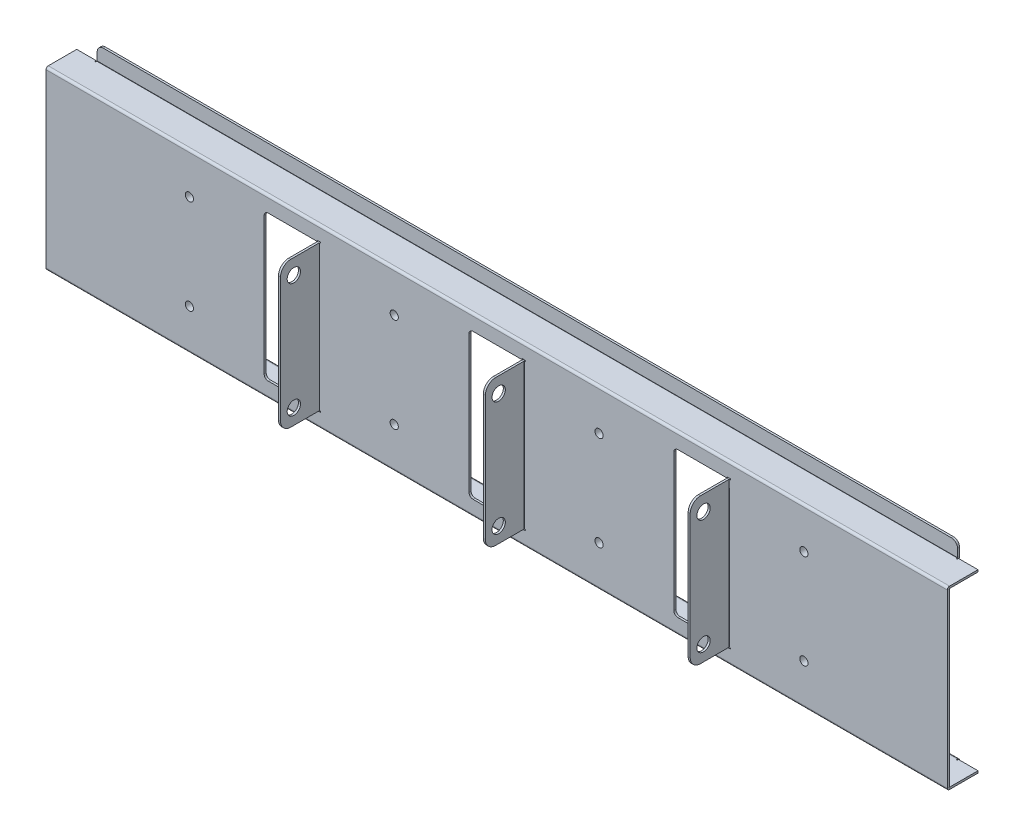
from build123d import *

# Parameters (mm, degrees)
SKETCH_1_W                          = 440
SKETCH_1_H                          = 86
SM_BASE_FLANGE_1_DEPTH              = 1
SM_EDGE_FLANGE_1_STRIP_W            = 4.2
SM_EDGE_FLANGE_1_STRIP_H            = 1
SM_EDGE_FLANGE_1_STRIP_CUT_DEPTH    = 440
SM_EDGE_FLANGE_1_STRIP_2_W          = 4.2
SM_EDGE_FLANGE_1_STRIP_2_H          = 1
SM_EDGE_FLANGE_1_STRIP_CUT_2_DEPTH  = 440
SM_EDGE_FLANGE_1_DEPTH              = 440
SM_EDGE_FLANGE_1_BEND_DEPTH         = 440
SM_EDGE_FLANGE_2_STRIP_W            = 5.2
SM_EDGE_FLANGE_2_STRIP_H            = 1
SM_EDGE_FLANGE_2_STRIP_CUT_DEPTH    = 420
SM_EDGE_FLANGE_2_RELIEF_W           = 5.7
SM_EDGE_FLANGE_2_RELIEF_H           = 0.5
SM_EDGE_FLANGE_2_RELIEF_CUT_DEPTH   = 1
SM_EDGE_FLANGE_2_STRIP_2_W          = 5.2
SM_EDGE_FLANGE_2_STRIP_2_H          = 1
SM_EDGE_FLANGE_2_STRIP_CUT_2_DEPTH  = 420
SM_EDGE_FLANGE_2_RELIEF_2_W         = 5.7
SM_EDGE_FLANGE_2_RELIEF_2_H         = 0.5
SM_EDGE_FLANGE_2_RELIEF_CUT_2_DEPTH = 1
SM_EDGE_FLANGE_2_DEPTH              = 420
SM_EDGE_FLANGE_2_BEND_DEPTH         = 420
SKETCH_18_W                         = 26
SKETCH_18_H                         = 71
CUT_EXTRUDE_1_DEPTH                 = 10
SM_START                            = -36
SM_EDGE_FLANGE_3_DEPTH              = 72
SM_EDGE_FLANGE_3_2_DEPTH            = 0.5
SM_START_2                          = 35.5
SM_EDGE_FLANGE_3_3_DEPTH            = 0.5
SM_START_3                          = -35.5
SM_EDGE_FLANGE_3_4_DEPTH            = 71
SKETCH_22_R                         = 3.25
CUT_EXTRUDE_2_DEPTH                 = 10
FILLET_1_R                          = 5
PATTERN_LINEAR_4_COUNT              = 2
PATTERN_LINEAR_4_PITCH              = 100
FILLET_1_OF_PATTERN_LINEAR_4_R      = 5
PATTERN_LINEAR_5_COUNT              = 2
PATTERN_LINEAR_5_PITCH              = 100
FILLET_1_OF_PATTERN_LINEAR_5_R      = 5
FILLET_2_R                          = 3
FILLET_3_R                          = 2
SKETCH_23_R                         = 2
CUT_EXTRUDE_3_DEPTH                 = 10
SKETCH_24_R                         = 4
SKETCH_24_R_2                       = 2
EXTRUDE_1_DEPTH                     = 3


# Read off the part's stored shape, not the designer's step: 边线-法兰3
# Sheet-metal steps are written as plain solids
with BuildPart() as part:
    # Sketch 1 → 基体-法兰1 (new body)
    with BuildSketch(Plane.XY):
        Rectangle(SKETCH_1_W, SKETCH_1_H)
    extrude(amount=-SM_BASE_FLANGE_1_DEPTH)

    # 边线-法兰1 strip (across the edge) → 边线-法兰1 strip cut (cut)
    with BuildSketch(Plane(origin=(-220, 43, -1), x_dir=(0, -1, 0), z_dir=(1, 0, 0))):
        with Locations((-1, -0.5)):
            Rectangle(SM_EDGE_FLANGE_1_STRIP_W, SM_EDGE_FLANGE_1_STRIP_H)
    extrude(amount=SM_EDGE_FLANGE_1_STRIP_CUT_DEPTH, mode=Mode.SUBTRACT)

    # 边线-法兰1 strip 2 (across the edge) → 边线-法兰1 strip cut 2 (cut)
    with BuildSketch(Plane(origin=(220, -43, -1), x_dir=(0, 1, 0), z_dir=(-1, 0, 0))):
        with Locations((-1, -0.5)):
            Rectangle(SM_EDGE_FLANGE_1_STRIP_2_W, SM_EDGE_FLANGE_1_STRIP_2_H)
    extrude(amount=SM_EDGE_FLANGE_1_STRIP_CUT_2_DEPTH, mode=Mode.SUBTRACT)

    # 边线-法兰1 section (across the edge) → 边线-法兰1 (add)
    with BuildSketch(Plane(origin=(-220, 43, -1), x_dir=(0, -1, 0), z_dir=(1, 0, 0))):
        with BuildLine():
            Line((0, 0.1), (0, 14))
            Line((0, 14), (1, 14))
            Line((1, 14), (1, 0.1))
            ThreePointArc((1, 0.1), (1.029289322, 0.029289322), (1.1, 0))
            Line((1.1, 0), (1.1, -1))
            ThreePointArc((1.1, -1), (0.322182541, -0.677817459), (0, 0.1))
        make_face()
    extrude(amount=SM_EDGE_FLANGE_1_DEPTH)

    # 边线-法兰1 section 2 (across the edge) → 边线-法兰1 bend (add)
    with BuildSketch(Plane(origin=(220, -43, -1), x_dir=(0, 1, 0), z_dir=(-1, 0, 0))):
        with BuildLine():
            Line((0, 0.1), (0, 14))
            Line((0, 14), (1, 14))
            Line((1, 14), (1, 0.1))
            ThreePointArc((1, 0.1), (1.029289322, 0.029289322), (1.1, 0))
            Line((1.1, 0), (1.1, -1))
            ThreePointArc((1.1, -1), (0.322182541, -0.677817459), (0, 0.1))
        make_face()
    extrude(amount=SM_EDGE_FLANGE_1_BEND_DEPTH)

    # 边线-法兰2 strip (across the edge) → 边线-法兰2 strip cut (cut)
    with BuildSketch(Plane(origin=(210, 43, -16), x_dir=(0, 0, 1), z_dir=(-1, 0, 0))):
        with Locations((-1.5, -0.5)):
            Rectangle(SM_EDGE_FLANGE_2_STRIP_W, SM_EDGE_FLANGE_2_STRIP_H)
    extrude(amount=SM_EDGE_FLANGE_2_STRIP_CUT_DEPTH, mode=Mode.SUBTRACT)

    # 边线-法兰2 relief (on the sheet) → 边线-法兰2 relief cut (cut)
    with BuildSketch(Plane(origin=(210, 43, -14.9), x_dir=(0, 0, 1), z_dir=(0, 1, 0))):
        with Locations((-2.35, 0.25)):
            Rectangle(SM_EDGE_FLANGE_2_RELIEF_W, SM_EDGE_FLANGE_2_RELIEF_H)
        with Locations((-2.35, -420.25)):
            Rectangle(SM_EDGE_FLANGE_2_RELIEF_W, SM_EDGE_FLANGE_2_RELIEF_H)
    extrude(amount=-SM_EDGE_FLANGE_2_RELIEF_CUT_DEPTH, mode=Mode.SUBTRACT)

    # 边线-法兰2 strip 2 (across the edge) → 边线-法兰2 strip cut 2 (cut)
    with BuildSketch(Plane(origin=(-210, -43, -16), x_dir=(0, 0, 1), z_dir=(1, 0, 0))):
        with Locations((-1.5, -0.5)):
            Rectangle(SM_EDGE_FLANGE_2_STRIP_2_W, SM_EDGE_FLANGE_2_STRIP_2_H)
    extrude(amount=SM_EDGE_FLANGE_2_STRIP_CUT_2_DEPTH, mode=Mode.SUBTRACT)

    # 边线-法兰2 relief 2 (on the sheet) → 边线-法兰2 relief cut 2 (cut)
    with BuildSketch(Plane(origin=(-210, -43, -14.9), x_dir=(0, 0, 1), z_dir=(0, -1, 0))):
        with Locations((-2.35, 0.25)):
            Rectangle(SM_EDGE_FLANGE_2_RELIEF_2_W, SM_EDGE_FLANGE_2_RELIEF_2_H)
        with Locations((-2.35, -420.25)):
            Rectangle(SM_EDGE_FLANGE_2_RELIEF_2_W, SM_EDGE_FLANGE_2_RELIEF_2_H)
    extrude(amount=-SM_EDGE_FLANGE_2_RELIEF_CUT_2_DEPTH, mode=Mode.SUBTRACT)

    # 边线-法兰2 section (across the edge) → 边线-法兰2 (add)
    with BuildSketch(Plane(origin=(210, 43, -16), x_dir=(0, 0, 1), z_dir=(-1, 0, 0))):
        with BuildLine():
            Line((0, 0.1), (0, 7))
            Line((0, 7), (1, 7))
            Line((1, 7), (1, 0.1))
            ThreePointArc((1, 0.1), (1.029289322, 0.029289322), (1.1, 0))
            Line((1.1, 0), (1.1, -1))
            ThreePointArc((1.1, -1), (0.322182541, -0.677817459), (0, 0.1))
        make_face()
    extrude(amount=SM_EDGE_FLANGE_2_DEPTH)

    # 边线-法兰2 section 2 (across the edge) → 边线-法兰2 bend (add)
    with BuildSketch(Plane(origin=(-210, -43, -16), x_dir=(0, 0, 1), z_dir=(1, 0, 0))):
        with BuildLine():
            Line((0, 0.1), (0, 7))
            Line((0, 7), (1, 7))
            Line((1, 7), (1, 0.1))
            ThreePointArc((1, 0.1), (1.029289322, 0.029289322), (1.1, 0))
            Line((1.1, 0), (1.1, -1))
            ThreePointArc((1.1, -1), (0.322182541, -0.677817459), (0, 0.1))
        make_face()
    extrude(amount=SM_EDGE_FLANGE_2_BEND_DEPTH)

    # 草图18 → 切除-拉伸1 (cut)
    with BuildSketch(Plane.XY):
        with Locations((-0.5, 0)):
            Rectangle(SKETCH_18_W, SKETCH_18_H)
    cut_extrude_1 = extrude(amount=-CUT_EXTRUDE_1_DEPTH, mode=Mode.SUBTRACT)

    # 边线-法兰3 outline → 边线-法兰3 (cut)
    with BuildSketch(Plane(origin=(0, 0, 0), x_dir=(1, 0, 0), z_dir=(0, 1, 0)).offset(SM_START)):
        with BuildLine():
            ThreePointArc((12.504554885, 0), (12.858380152, 0.71240384), (13.6, 1))
            Line((13.6, 1), (12.5, 1))
            Line((12.5, 1), (12.5, 0))
            Line((12.5, 0), (12.504554885, 0))
        make_face()
    sm_edge_flange_3 = extrude(amount=SM_EDGE_FLANGE_3_DEPTH, mode=Mode.SUBTRACT)

    # Sm Edge Flange 3 2 outline → Sm Edge Flange 3 2 (cut)
    with BuildSketch(Plane(origin=(0, 0, 0), x_dir=(1, 0, 0), z_dir=(0, 1, 0)).offset(SM_START)):
        with BuildLine():
            Line((14.1, 0), (14.1, 1))
            Line((14.1, 1), (13.6, 1))
            ThreePointArc((13.6, 1), (12.858380152, 0.71240384), (12.504554885, 0))
            Line((12.504554885, 0), (14.1, 0))
        make_face()
    sm_edge_flange_3_2 = extrude(amount=SM_EDGE_FLANGE_3_2_DEPTH, mode=Mode.SUBTRACT)

    # Sm Edge Flange 3 3 outline → Sm Edge Flange 3 3 (cut)
    with BuildSketch(Plane(origin=(0, 0, 0), x_dir=(1, 0, 0), z_dir=(0, 1, 0)).offset(SM_START_2)):
        with BuildLine():
            Line((14.1, 0), (14.1, 1))
            Line((14.1, 1), (13.6, 1))
            ThreePointArc((13.6, 1), (12.858380152, 0.71240384), (12.504554885, 0))
            Line((12.504554885, 0), (14.1, 0))
        make_face()
    sm_edge_flange_3_3 = extrude(amount=SM_EDGE_FLANGE_3_3_DEPTH, mode=Mode.SUBTRACT)

    # Sm Edge Flange 3 4 outline → Sm Edge Flange 3 4 (add)
    with BuildSketch(Plane(origin=(0, 0, 0), x_dir=(1, 0, 0), z_dir=(0, 1, 0)).offset(SM_START_3)):
        with BuildLine():
            ThreePointArc((13.5, -0.1), (13.529289322, -0.029289322), (13.6, 0))
            Line((13.6, 0), (12.504554885, 0))
            ThreePointArc((12.504554885, 0), (12.501139311, -0.049948159), (12.5, -0.1))
            Line((12.5, -0.1), (12.5, -19))
            Line((12.5, -19), (13.5, -19))
            Line((13.5, -19), (13.5, -0.1))
        make_face()
    sm_edge_flange_3_4 = extrude(amount=SM_EDGE_FLANGE_3_4_DEPTH)

    # 草图22 → 切除-拉伸2 (cut)
    with BuildSketch(Plane.ZY.offset(-12.5)):
        with Locations((12.5, 28)):
            Circle(SKETCH_22_R)
        with Locations((12.5, -28)):
            Circle(SKETCH_22_R)
    cut_extrude_2 = extrude(amount=-CUT_EXTRUDE_2_DEPTH, mode=Mode.SUBTRACT)

    # 圆角1
    fillet_1_edges = [part.edges().sort_by_distance(p)[0] for p in [
        (13, 35.5, 19),
        (13, -35.5, 19),
    ]]
    fillet(fillet_1_edges, radius=FILLET_1_R)

    # 阵列(线性)4: 切除-拉伸1, 边线-法兰3, Sm Edge Flange 3 2, Sm Edge Flange 3 3, Sm Edge Flange 3 4, 切除-拉伸2 ×2
    with Locations(*[(i * PATTERN_LINEAR_4_PITCH, 0, 0) for i in range(1, PATTERN_LINEAR_4_COUNT)]):
        add(cut_extrude_1, mode=Mode.SUBTRACT)
        add(sm_edge_flange_3, mode=Mode.SUBTRACT)
        add(sm_edge_flange_3_2, mode=Mode.SUBTRACT)
        add(sm_edge_flange_3_3, mode=Mode.SUBTRACT)
        add(sm_edge_flange_3_4)
        add(cut_extrude_2, mode=Mode.SUBTRACT)

    # 圆角1 of 阵列(线性)4
    fillet_1_of_pattern_linear_4_edges = [part.edges().sort_by_distance(p)[0] for p in [
        (113, 35.5, 19),
        (113, -35.5, 19),
    ]]
    fillet(fillet_1_of_pattern_linear_4_edges, radius=FILLET_1_OF_PATTERN_LINEAR_4_R)

    # 阵列(线性)5: 切除-拉伸1, 边线-法兰3, Sm Edge Flange 3 2, Sm Edge Flange 3 3, Sm Edge Flange 3 4, 切除-拉伸2 ×2
    with Locations(*[(-i * PATTERN_LINEAR_5_PITCH, 0, 0) for i in range(1, PATTERN_LINEAR_5_COUNT)]):
        add(cut_extrude_1, mode=Mode.SUBTRACT)
        add(sm_edge_flange_3, mode=Mode.SUBTRACT)
        add(sm_edge_flange_3_2, mode=Mode.SUBTRACT)
        add(sm_edge_flange_3_3, mode=Mode.SUBTRACT)
        add(sm_edge_flange_3_4)
        add(cut_extrude_2, mode=Mode.SUBTRACT)

    # 圆角1 of 阵列(线性)5
    fillet_1_of_pattern_linear_5_edges = [part.edges().sort_by_distance(p)[0] for p in [
        (-87, 35.5, 19),
        (-87, -35.5, 19),
    ]]
    fillet(fillet_1_of_pattern_linear_5_edges, radius=FILLET_1_OF_PATTERN_LINEAR_5_R)

    # 圆角2
    fillet_2_edges = [part.edges().sort_by_distance(p)[0] for p in [
        (210, 50, -15.5),
        (-210, 50, -15.5),
        (-210, -50, -15.5),
        (210, -50, -15.5),
    ]]
    fillet(fillet_2_edges, radius=FILLET_2_R)

    # 圆角3
    fillet_3_edges = [part.edges().sort_by_distance(p)[0] for p in [
        (-13.5, -35.5, -0.5),
        (-13.5, 35.5, -0.5),
        (86.5, -35.5, -0.5),
        (86.5, 35.5, -0.5),
        (-113.5, -35.5, -0.5),
        (-113.5, 35.5, -0.5),
    ]]
    fillet(fillet_3_edges, radius=FILLET_3_R)

    # 草图23 → 切除-拉伸3 (cut)
    with BuildSketch(Plane.XY):
        with Locations((-150, 23.1)):
            Circle(SKETCH_23_R)
        with Locations((-150, -23.1)):
            Circle(SKETCH_23_R)
        with Locations((-50, 23.1)):
            Circle(SKETCH_23_R)
        with Locations((-50, -23.1)):
            Circle(SKETCH_23_R)
        with Locations((50, 23.1)):
            Circle(SKETCH_23_R)
        with Locations((50, -23.1)):
            Circle(SKETCH_23_R)
        with Locations((150, 23.1)):
            Circle(SKETCH_23_R)
        with Locations((150, -23.1)):
            Circle(SKETCH_23_R)
    extrude(amount=-CUT_EXTRUDE_3_DEPTH, mode=Mode.SUBTRACT)

    # 草图24 → 凸台-拉伸1 (add)
    # profile 1 of 8: a face of its own
    with BuildSketch(Plane(origin=(0, 0, -1), x_dir=(-1, 0, 0), z_dir=(0, 0, -1))):
        with Locations(Location((-150, 23.1, 0), (0, 0, 180))):
            Circle(SKETCH_24_R)
        with Locations(Location((-150, 23.1, 0), (0, 0, 180))):
            Circle(SKETCH_24_R_2, mode=Mode.SUBTRACT)
    # profile 2 of 8: a face of its own
    with BuildSketch(Plane(origin=(0, 0, -1), x_dir=(-1, 0, 0), z_dir=(0, 0, -1))):
        with Locations(Location((-150, -23.1, 0), (0, 0, 180))):
            Circle(SKETCH_24_R)
        with Locations(Location((-150, -23.1, 0), (0, 0, 180))):
            Circle(SKETCH_24_R_2, mode=Mode.SUBTRACT)
    # profile 3 of 8: a face of its own
    with BuildSketch(Plane(origin=(0, 0, -1), x_dir=(-1, 0, 0), z_dir=(0, 0, -1))):
        with Locations(Location((-50, 23.1, 0), (0, 0, 180))):
            Circle(SKETCH_24_R)
        with Locations(Location((-50, 23.1, 0), (0, 0, 180))):
            Circle(SKETCH_24_R_2, mode=Mode.SUBTRACT)
    # profile 4 of 8: a face of its own
    with BuildSketch(Plane(origin=(0, 0, -1), x_dir=(-1, 0, 0), z_dir=(0, 0, -1))):
        with Locations(Location((-50, -23.1, 0), (0, 0, 180))):
            Circle(SKETCH_24_R)
        with Locations(Location((-50, -23.1, 0), (0, 0, 180))):
            Circle(SKETCH_24_R_2, mode=Mode.SUBTRACT)
    # profile 5 of 8: a face of its own
    with BuildSketch(Plane(origin=(0, 0, -1), x_dir=(-1, 0, 0), z_dir=(0, 0, -1))):
        with Locations(Location((50, 23.1, 0), (0, 0, 180))):
            Circle(SKETCH_24_R)
        with Locations(Location((50, 23.1, 0), (0, 0, 180))):
            Circle(SKETCH_24_R_2, mode=Mode.SUBTRACT)
    # profile 6 of 8: a face of its own
    with BuildSketch(Plane(origin=(0, 0, -1), x_dir=(-1, 0, 0), z_dir=(0, 0, -1))):
        with Locations(Location((50, -23.1, 0), (0, 0, 180))):
            Circle(SKETCH_24_R)
        with Locations(Location((50, -23.1, 0), (0, 0, 180))):
            Circle(SKETCH_24_R_2, mode=Mode.SUBTRACT)
    # profile 7 of 8: a face of its own
    with BuildSketch(Plane(origin=(0, 0, -1), x_dir=(-1, 0, 0), z_dir=(0, 0, -1))):
        with Locations(Location((150, 23.1, 0), (0, 0, 180))):
            Circle(SKETCH_24_R)
        with Locations(Location((150, 23.1, 0), (0, 0, 180))):
            Circle(SKETCH_24_R_2, mode=Mode.SUBTRACT)
    # profile 8 of 8: a face of its own
    with BuildSketch(Plane(origin=(0, 0, -1), x_dir=(-1, 0, 0), z_dir=(0, 0, -1))):
        with Locations(Location((150, -23.1, 0), (0, 0, 180))):
            Circle(SKETCH_24_R)
        with Locations(Location((150, -23.1, 0), (0, 0, 180))):
            Circle(SKETCH_24_R_2, mode=Mode.SUBTRACT)
    extrude(amount=EXTRUDE_1_DEPTH)


solid = part.part
